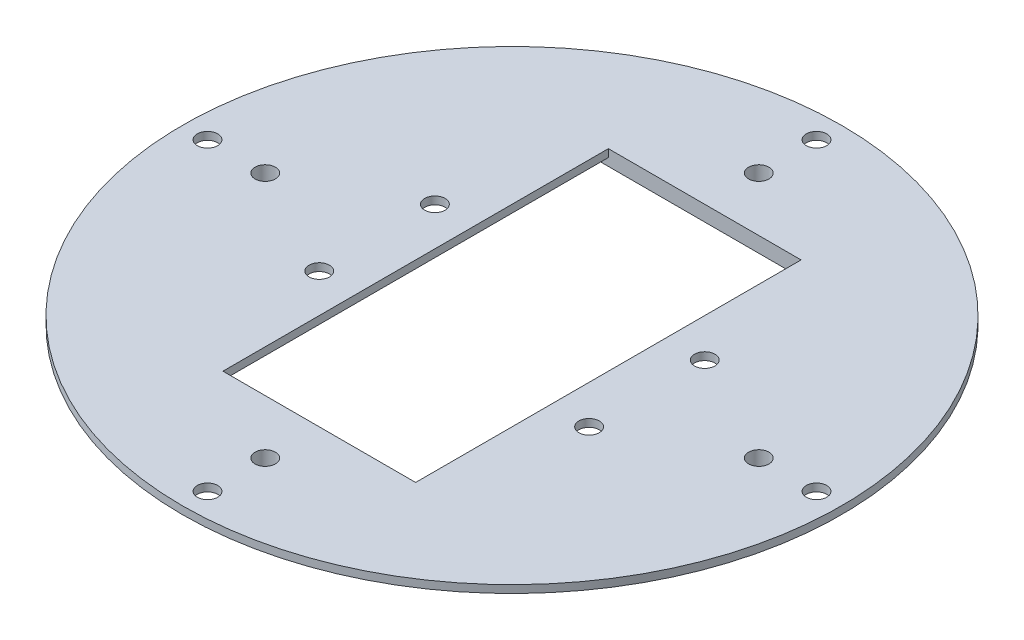
from build123d import *
from build123d.topology import SkipClean

# Parameters (mm, degrees)
SKETCH_1_R            = 85.5
SKETCH_1_R_2          = 2.65
EXTRUDE_1_DEPTH       = 2
SKETCH_2_W            = 40
SKETCH_2_H            = 100
CUT_EXTRUDE_2_DEPTH   = 2
SKETCH_4_R            = 2.65
CUT_EXTRUDE_3_DEPTH   = 2
SKETCH_5_W            = 15
SKETCH_5_H            = 100
EXTRUDE_2_DEPTH       = 2
SKETCH_7_R            = 2.65
CUT_EXTRUDE_4_DEPTH   = 2
EXTRUDE_4_OUTLINE_R   = 72.5
EXTRUDE_4_OUTLINE_R_2 = 2.65
EXTRUDE_4_OUTLINE_W   = 100
EXTRUDE_4_OUTLINE_H   = 100
EXTRUDE_4_DEPTH       = 2


# Read off the part's stored shape, not the designer's step: 凸台-拉伸4
with BuildPart() as part:
    # 草图1 → 凸台-拉伸1 (new body)
    with BuildSketch(Plane(origin=(0, 0, 0), x_dir=(1, 0, 0), z_dir=(0, 1, 0))):
        with Locations(Location((0, 0, 0), (0, 0, 270))):
            Circle(SKETCH_1_R)
        with Locations(Location((0, 79, 0), (0, 0, 270))):
            Circle(SKETCH_1_R_2, mode=Mode.SUBTRACT)
        with Locations(Location((79, 0, 0), (0, 0, 270))):
            Circle(SKETCH_1_R_2, mode=Mode.SUBTRACT)
        with Locations(Location((0, -79, 0), (0, 0, 270))):
            Circle(SKETCH_1_R_2, mode=Mode.SUBTRACT)
        with Locations(Location((-79, 0, 0), (0, 0, 270))):
            Circle(SKETCH_1_R_2, mode=Mode.SUBTRACT)
    extrude(amount=EXTRUDE_1_DEPTH)

    # 草图2 → 切除-拉伸2 (cut)
    with BuildSketch(Plane(origin=(0, 2, 0), x_dir=(1, 0, 0), z_dir=(0, 1, 0))):
        with Locations((-20, 0)):
            Rectangle(SKETCH_2_W, SKETCH_2_H)
        with Locations((20, 0)):
            Rectangle(SKETCH_2_W, SKETCH_2_H)
    extrude(amount=-CUT_EXTRUDE_2_DEPTH, mode=Mode.SUBTRACT)

    # 草图4 → 切除-拉伸3 (cut)
    with BuildSketch(Plane(origin=(0, 2, 0), x_dir=(1, 0, 0), z_dir=(0, 1, 0))):
        with Locations(Location((0, 64.031242374, 0), (0, 0, 270))):
            Circle(SKETCH_4_R)
        with Locations(Location((64.031242374, 0, 0), (0, 0, 270))):
            Circle(SKETCH_4_R)
        with Locations(Location((0, -64.031242374, 0), (0, 0, 270))):
            Circle(SKETCH_4_R)
        with Locations(Location((-64.031242374, 0, 0), (0, 0, 270))):
            Circle(SKETCH_4_R)
    extrude(amount=-CUT_EXTRUDE_3_DEPTH, mode=Mode.SUBTRACT)

    # 草图5 → 凸台-拉伸2 (add)
    with BuildSketch(Plane(origin=(0, 2, 0), x_dir=(1, 0, 0), z_dir=(0, 1, 0))):
        with Locations((-32.5, 0)):
            Rectangle(SKETCH_5_W, SKETCH_5_H)
        with Locations((32.5, 0)):
            Rectangle(SKETCH_5_W, SKETCH_5_H)
    extrude(amount=-EXTRUDE_2_DEPTH)

    # 草图7 → 切除-拉伸4 (cut)
    with BuildSketch(Plane(origin=(0, 2, 0), x_dir=(1, 0, 0), z_dir=(0, 1, 0))):
        with Locations(Location((35, 15, 0), (0, 0, 270))):
            Circle(SKETCH_7_R)
        with Locations(Location((35, -15, 0), (0, 0, 270))):
            Circle(SKETCH_7_R)
        with Locations(Location((-35, -15, 0), (0, 0, 270))):
            Circle(SKETCH_7_R)
        with Locations(Location((-35, 15, 0), (0, 0, 270))):
            Circle(SKETCH_7_R)
    extrude(amount=-CUT_EXTRUDE_4_DEPTH, mode=Mode.SUBTRACT)

    # 凸台-拉伸4 outline → 凸台-拉伸4 (add)
    with SkipClean():  # the faces are left unmerged after this step: merging them gives an invalid solid
        with BuildSketch(Plane.XZ):
            Circle(EXTRUDE_4_OUTLINE_R)
            with Locations((0, -64.031242374)):
                Circle(EXTRUDE_4_OUTLINE_R_2, mode=Mode.SUBTRACT)
            with Locations((-64.031242374, 0)):
                Circle(EXTRUDE_4_OUTLINE_R_2, mode=Mode.SUBTRACT)
            Rectangle(EXTRUDE_4_OUTLINE_W, EXTRUDE_4_OUTLINE_H, mode=Mode.SUBTRACT)
            with Locations((64.031242374, 0)):
                Circle(EXTRUDE_4_OUTLINE_R_2, mode=Mode.SUBTRACT)
            with Locations((0, 64.031242374)):
                Circle(EXTRUDE_4_OUTLINE_R_2, mode=Mode.SUBTRACT)
        extrude(amount=EXTRUDE_4_DEPTH)
    add(part.part.scale(1), mode=Mode.REPLACE)  # the faces are merged on a copy


solid = part.part
